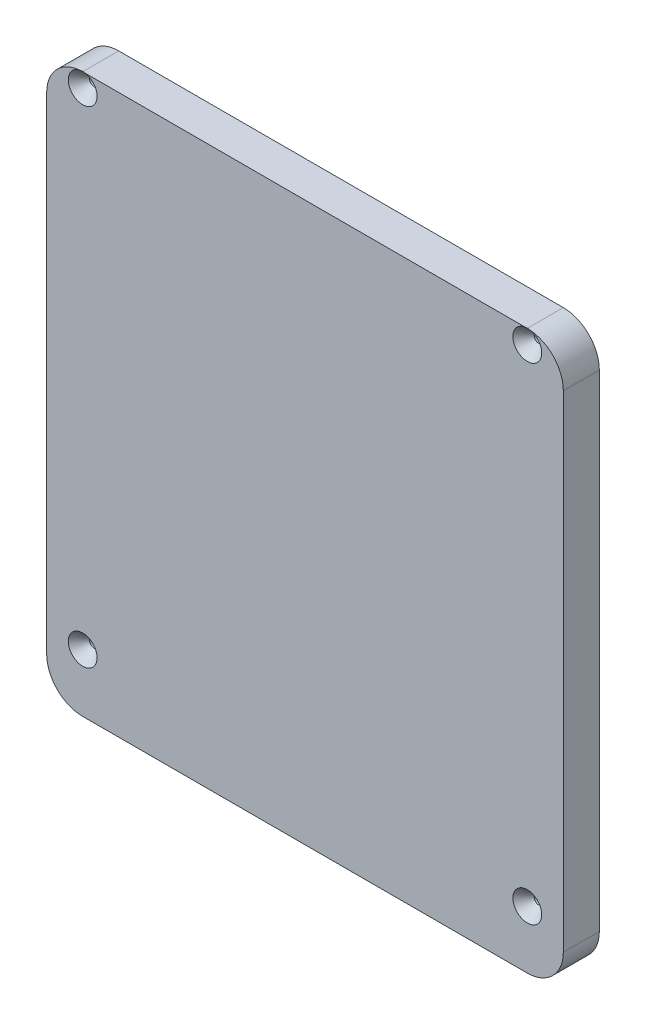
from build123d import *

# Parameters (mm, degrees)
SKETCH1_W           = 182.149999994
SKETCH1_H           = 196.85
BOSS_EXTRUDE1_DEPTH = 12.7
FILLET1_R           = 12.7
HOLE1_D             = 3.175
HOLE1_DEPTH         = 31.75
HOLE1_CSINK_D       = 10.16
HOLE1_CSINK_ANGLE   = 82
HOLE1_TIP           = 0.953866233


with BuildPart() as part:
    # Sketch1 → Boss-Extrude1 (new body)
    with BuildSketch(Plane.XY):
        with Locations((47.975000003, 766.50216301)):
            Rectangle(SKETCH1_W, SKETCH1_H)
    extrude(amount=BOSS_EXTRUDE1_DEPTH)

    # Fillet1
    fillet1_edges = [part.edges().sort_by_distance(p)[0] for p in [
        (139.05, 864.92716301, 6.35),
        (139.05, 668.07716301, 6.35),
        (-43.099999994, 668.07716301, 6.35),
        (-43.099999994, 864.92716301, 6.35),
    ]]
    fillet(fillet1_edges, radius=FILLET1_R)

    # Hole1
    with Locations(Plane(origin=(47.975000003, -433.115333272, 12.7), x_dir=(1, 0, 0), z_dir=(0, 0, 1))):
        with Locations((-78.374999997, 1293.039195846), (-78.374999997, 1121.589195846), (78.374999997, 1121.589195846), (78.374999997, 1293.039195846), (-764.015524801, 1530.078195669)):
            CounterSinkHole(HOLE1_D / 2, HOLE1_CSINK_D / 2, depth=HOLE1_DEPTH, counter_sink_angle=HOLE1_CSINK_ANGLE)
            with Locations((0, 0, -(HOLE1_DEPTH + HOLE1_TIP / 2))):  # 118° drill point
                Cone(0, HOLE1_D / 2, HOLE1_TIP, mode=Mode.SUBTRACT)


solid = part.part
